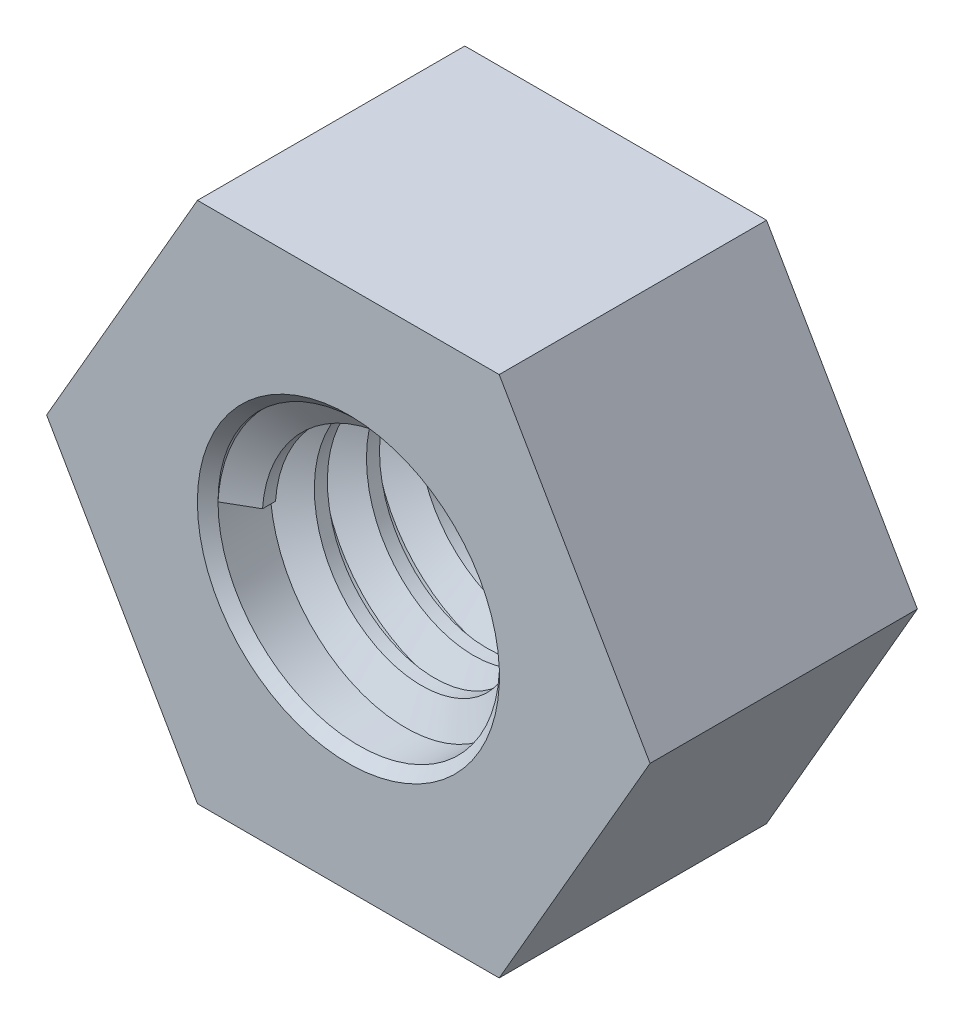
from build123d import *

# Parameters (mm, degrees)
SKETCH1_R           = 3.81
BOSS_EXTRUDE1_DEPTH = 3.6195
CHAMFER1_SIZE       = 0.2794
THREAD1_PITCH       = 1.411111111


with BuildPart() as part:
    # Sketch1 → Boss-Extrude1 (new, symmetric)
    with BuildSketch(Plane.XY):
        Polygon((-4.087173661, 7.07205005), (4.08305, 7.07205005), (8.16816183, -0.003571195), (4.08305, -7.07919244), (-4.087173661, -7.07919244), (-8.172285491, -0.003571195), align=None)
        Circle(SKETCH1_R, mode=Mode.SUBTRACT)
    extrude(amount=BOSS_EXTRUDE1_DEPTH, both=True)

    # Chamfer1
    chamfer1_edges = [part.edges().sort_by_distance(p)[0] for p in [
        (-3.81, 0, -3.6195),
        (-3.81, 0, 3.6195),
    ]]
    chamfer(chamfer1_edges, length=CHAMFER1_SIZE)

    # Thread1: arcs per turn and ends read off the stored shape
    # Thread1: the profile of Thread Profile2 profile screwed along a right-hand helix through 4.223336 turns, 8 arcs to a turn; built about Z, then put on its axis
    thread1_z = Axis((0, 0, 0), (0, 0, 1))
    thread1_corners = [(3.8103, 0, -0.000173205), (3.8103, 0, 1.234895423), (3.04621371, 0, 0.793749998), (3.04621371, 0, 0.44097222)]
    with BuildLine(mode=Mode.PRIVATE) as thread1_profile:
        Line(thread1_corners[0], thread1_corners[1])
        Line(thread1_corners[1], thread1_corners[2])
        Line(thread1_corners[2], thread1_corners[3])
        Line(thread1_corners[3], thread1_corners[0])
    thread1_cap = Face(thread1_profile.wire())
    thread1_turn_angles = [0, 22.5, 45, 67.5, 90, 112.5, 135, 157.5, 180, 202.5, 225, 247.5, 270, 292.5, 315, 337.5, 360]
    thread1_turn_weights = [1, 0.9238795325112867, 1, 0.9238795325112867, 1, 0.9238795325112867, 1, 0.9238795325112867, 1, 0.9238795325112867, 1, 0.9238795325112867, 1, 0.9238795325112867, 1, 0.9238795325112867, 1]
    thread1_turn_rails = [Edge.make_bspline([Vector(p[0], p[1], 0).rotate(thread1_z, thread1_turn_angles[k]) / thread1_turn_weights[k] + Vector(0, 0, p[2] + THREAD1_PITCH * thread1_turn_angles[k] / 360) for k in range(17)], [0, 0, 0, 1, 1, 2, 2, 3, 3, 4, 4, 5, 5, 6, 6, 7, 7, 8, 8, 8], 2, thread1_turn_weights) for p in thread1_corners]
    thread1_turn_sides = [Face.make_surface_from_curves(thread1_turn_rails[p[0]], thread1_turn_rails[p[1]]) for p in [(0, 1), (1, 2), (2, 3), (3, 0)]]
    thread1_last_angles = [1440, 1462.5, 1485, 1502.7005, 1520.401]
    thread1_last_weights = [1, 0.9238795325112867, 1, 0.9526588280283375, 1]
    thread1_last_rails = [Edge.make_bspline([Vector(p[0], p[1], 0).rotate(thread1_z, thread1_last_angles[k]) / thread1_last_weights[k] + Vector(0, 0, p[2] + THREAD1_PITCH * thread1_last_angles[k] / 360) for k in range(5)], [0, 0, 0, 1, 1, 2, 2, 2], 2, thread1_last_weights) for p in thread1_corners]
    thread1_last_sides = [Face.make_surface_from_curves(thread1_last_rails[p[0]], thread1_last_rails[p[1]]) for p in [(0, 1), (1, 2), (2, 3), (3, 0)]]
    thread1 = Plane(origin=(0, 0, 3.3401), x_dir=(-1, 0, 0), z_dir=(0, 0, -1)) * Solid(Shell([*[p.moved(Location((0, 0, THREAD1_PITCH * i))) for i in range(4) for p in thread1_turn_sides], *thread1_last_sides, thread1_cap, thread1_cap.rotate(thread1_z, 1520.401).moved(Location((0, 0, THREAD1_PITCH * 1520.401 / 360)))]))
    add(thread1)


solid = part.part
